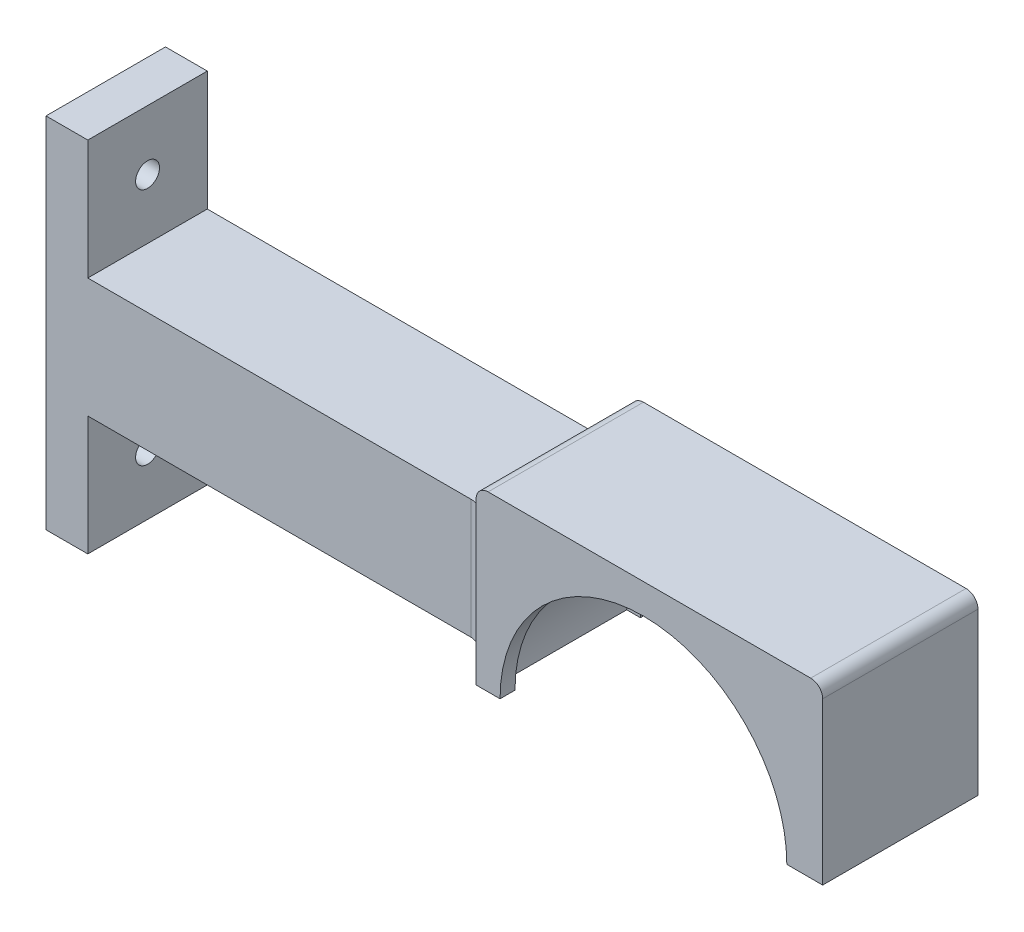
from build123d import *

# Parameters (mm, degrees)
SKETCH_5_W          = 28
SKETCH_5_H          = 13
EXTRUDE_4_DEPTH     = 13.5
SKETCH_6_W          = 13.15
SKETCH_6_H          = 10.5
SKETCH_8_R          = 12
CUT_EXTRUDE_1_DEPTH = 13
SKETCH_9_W          = 28
SKETCH_9_H          = 13
EXTRUDE_5_DEPTH     = 1
SKETCH_11_W         = 13
SKETCH_11_H         = 14.5
EXTRUDE_6_DEPTH     = 1
FILLET_1_R          = 1
SKETCH_12_W         = 10
SKETCH_12_H         = 10
EXTRUDE_7_DEPTH     = 37.5
SKETCH_13_W         = 10
SKETCH_13_H         = 30
SKETCH_13_R         = 1
EXTRUDE_8_DEPTH     = 3.5
FILLET_2_R          = 2
FILLET_3_R          = 1


with BuildPart() as part:
    # 스케치5 → 보스-돌출4 (new body)
    with BuildSketch(Plane(origin=(0, 0, 0), x_dir=(1, 0, 0), z_dir=(0, 1, 0))):
        Rectangle(SKETCH_5_W, SKETCH_5_H)
    extrude(amount=EXTRUDE_4_DEPTH)

    # 컷-스윕1: sweep along a path in 스케치7
    with BuildLine(Plane.XY.offset(6.5)) as sweep_1_path:
        CenterArc((0, 0), 13.15, 0, 360)
    # 스케치6 → 컷-스윕1 (sweep, cut)
    with BuildSketch(Plane.XZ):
        with Locations((6.575, 0)):
            Rectangle(SKETCH_6_W, SKETCH_6_H)
    sweep(path=sweep_1_path.line, mode=Mode.SUBTRACT)

    # 스케치8 → 컷-돌출1 (cut)
    with BuildSketch(Plane.XY.offset(6.5)):
        Circle(SKETCH_8_R)
    extrude(amount=-CUT_EXTRUDE_1_DEPTH, mode=Mode.SUBTRACT)

    # 스케치9 → 보스-돌출5 (add)
    with BuildSketch(Plane(origin=(0, 13.5, 0), x_dir=(1, 0, 0), z_dir=(0, 1, 0))):
        Rectangle(SKETCH_9_W, SKETCH_9_H)
    extrude(amount=EXTRUDE_5_DEPTH)

    # 스케치11 → 보스-돌출6 (add)
    with BuildSketch(Plane(origin=(14, 0, 0), x_dir=(0, 0, -1), z_dir=(1, 0, 0))):
        with Locations((0, 7.25)):
            Rectangle(SKETCH_11_W, SKETCH_11_H)
    extrude(amount=EXTRUDE_6_DEPTH)

    # 필렛1
    fillet_1_edges = [part.edges().sort_by_distance(p)[0] for p in [
        (-14, 14.5, 0),
        (15, 14.5, 0),
    ]]
    fillet(fillet_1_edges, radius=FILLET_1_R)

    # 스케치12 → 보스-돌출7 (add)
    with BuildSketch(Plane.ZY.offset(14)):
        with Locations((0, 6.75)):
            Rectangle(SKETCH_12_W, SKETCH_12_H)
    extrude(amount=EXTRUDE_7_DEPTH)

    # 스케치13 → 보스-돌출8 (add)
    with BuildSketch(Plane.ZY.offset(51.5)):
        with Locations((0, 6.75)):
            Rectangle(SKETCH_13_W, SKETCH_13_H)
        with Locations((0, 16.75)):
            Circle(SKETCH_13_R, mode=Mode.SUBTRACT)
        with Locations((0, -3.25)):
            Circle(SKETCH_13_R, mode=Mode.SUBTRACT)
    extrude(amount=-EXTRUDE_8_DEPTH)

    # 필렛2
    # the kernel refuses this fillet: 2 mm, written as the material it adds along each edge
    with BuildSketch(Plane(origin=(-14, 11.75, 5), x_dir=(0, 0, 1), z_dir=(0, -1, 0)), Plane(origin=(-14, 1.75, -5), x_dir=(0, 0, -1), z_dir=(0, 1, 0))) as fillet_2_piece_1:
        with BuildLine():
            CenterArc((2, 1.936491673), FILLET_2_R, 180, 75.522487814)
            Line((0, 1.936491673), (-0.04, 1.936491673))
            Line((-0.04, 1.936491673), (-0.04, 0))
            Line((-0.04, 0), (0, -0.04))
            ThreePointArc((0, -0.04), (0.75, -0.04), (1.49, -0.038729833))
            Line((1.49, -0.038729833), (1.5, 0))
        make_face()
    extrude(amount=10)
    with BuildSketch(Plane(origin=(-14, 1.75, 5), x_dir=(0, -1, 0), z_dir=(0, 0, -1))) as fillet_2_piece_2:
        with BuildLine():
            CenterArc((2, 1.984313483), FILLET_2_R, 180, 82.819244219)
            Line((0, 1.984313483), (-0.04, 1.984313483))
            Line((-0.04, 1.984313483), (-0.04, 0))
            Line((-0.04, 0), (0, -0.04))
            ThreePointArc((0, -0.04), (0.875, -0.04), (1.745, -0.03968627))
            Line((1.745, -0.03968627), (1.75, 0))
        make_face()
    extrude(amount=10)
    with BuildSketch(Plane(origin=(-14, 11.75, 5), x_dir=(0, 0, 1), z_dir=(0, -1, 0))) as fillet_2_piece_3a_section:
        with BuildLine():
            CenterArc((2, 1.936491673), FILLET_2_R, 180, 75.522487814)
            Line((0, 1.936491673), (-0.04, 1.936491673))
            Line((-0.04, 1.936491673), (-0.04, 0))
            Line((-0.04, 0), (0, -0.04))
            ThreePointArc((0, -0.04), (0.75, -0.04), (1.49, -0.038729833))
            Line((1.49, -0.038729833), (1.5, 0))
        make_face()
    fillet_2_piece_3a = extrude(amount=14.841229183, mode=Mode.PRIVATE)
    fillet_2_piece_3a = split(fillet_2_piece_3a, bisect_by=Plane(origin=(-14.456288202, 0, 5.379183511), z_dir=(0, 1, 0)), keep=Keep.TOP, mode=Mode.PRIVATE)
    fillet_2_piece_3a = split(fillet_2_piece_3a, bisect_by=Plane(origin=(-14.456288202, 1.75, 5.379183511), z_dir=(0, -1, 0)), keep=Keep.TOP, mode=Mode.PRIVATE)
    with BuildSketch(Plane(origin=(-14, 1.75, 9.960783708), x_dir=(0, -1, 0), z_dir=(0, 0, -1))) as fillet_2_piece_3b_section:
        with BuildLine():
            CenterArc((2, 1.984313483), FILLET_2_R, 180, 82.819244219)
            Line((0, 1.984313483), (-0.04, 1.984313483))
            Line((-0.04, 1.984313483), (-0.04, 0))
            Line((-0.04, 0), (0, -0.04))
            ThreePointArc((0, -0.04), (0.875, -0.04), (1.745, -0.03968627))
            Line((1.745, -0.03968627), (1.75, 0))
        make_face()
    fillet_2_piece_3b = extrude(amount=14.960783708, mode=Mode.PRIVATE)
    fillet_2_piece_3b = split(fillet_2_piece_3b, bisect_by=Plane(origin=(-14.456897386, 1.324929313, 6.5), z_dir=(0, 0, -1)), keep=Keep.TOP, mode=Mode.PRIVATE)
    fillet_2_piece_3b = split(fillet_2_piece_3b, bisect_by=Plane(origin=(-14.456897386, 1.324929313, 5), z_dir=(0, 0, 1)), keep=Keep.TOP, mode=Mode.PRIVATE)
    fillet_2_piece_3 = fillet_2_piece_3a & fillet_2_piece_3b
    add(fillet_2_piece_3)
    with BuildSketch(Plane(origin=(-14, 1.75, 5), x_dir=(0, -1, 0), z_dir=(0, 0, -1))) as fillet_2_piece_4a_section:
        with BuildLine():
            CenterArc((2, 1.984313483), FILLET_2_R, 180, 82.819244219)
            Line((0, 1.984313483), (-0.04, 1.984313483))
            Line((-0.04, 1.984313483), (-0.04, 0))
            Line((-0.04, 0), (0, -0.04))
            ThreePointArc((0, -0.04), (0.875, -0.04), (1.745, -0.03968627))
            Line((1.745, -0.03968627), (1.75, 0))
        make_face()
    fillet_2_piece_4a = extrude(amount=14.960783708, mode=Mode.PRIVATE)
    fillet_2_piece_4a = split(fillet_2_piece_4a, bisect_by=Plane(origin=(-14.456897386, 1.324929313, -6.5), z_dir=(0, 0, 1)), keep=Keep.TOP, mode=Mode.PRIVATE)
    fillet_2_piece_4a = split(fillet_2_piece_4a, bisect_by=Plane(origin=(-14.456897386, 1.324929313, -5), z_dir=(0, 0, -1)), keep=Keep.TOP, mode=Mode.PRIVATE)
    with BuildSketch(Plane(origin=(-14, -3.091229183, -5), x_dir=(0, 0, -1), z_dir=(0, 1, 0))) as fillet_2_piece_4b_section:
        with BuildLine():
            CenterArc((2, 1.936491673), FILLET_2_R, 180, 75.522487814)
            Line((0, 1.936491673), (-0.04, 1.936491673))
            Line((-0.04, 1.936491673), (-0.04, 0))
            Line((-0.04, 0), (0, -0.04))
            ThreePointArc((0, -0.04), (0.75, -0.04), (1.49, -0.038729833))
            Line((1.49, -0.038729833), (1.5, 0))
        make_face()
    fillet_2_piece_4b = extrude(amount=14.841229183, mode=Mode.PRIVATE)
    fillet_2_piece_4b = split(fillet_2_piece_4b, bisect_by=Plane(origin=(-14.456288202, 0, -5.379183511), z_dir=(0, 1, 0)), keep=Keep.TOP, mode=Mode.PRIVATE)
    fillet_2_piece_4b = split(fillet_2_piece_4b, bisect_by=Plane(origin=(-14.456288202, 1.75, -5.379183511), z_dir=(0, -1, 0)), keep=Keep.TOP, mode=Mode.PRIVATE)
    fillet_2_piece_4 = fillet_2_piece_4a & fillet_2_piece_4b
    add(fillet_2_piece_4)

    # 필렛3
    # the kernel refuses this fillet: 1 mm, written as the material it adds along each edge
    with BuildSketch(Plane(origin=(-14, 11.75, 6.5), x_dir=(0, 1, 0), z_dir=(0, 0, -1))) as fillet_3_piece_1_section:
        with BuildLine():
            CenterArc((FILLET_3_R, -FILLET_3_R), FILLET_3_R, 90, 90)
            Line((0, -FILLET_3_R), (0, 0))
            Line((0, 0), (FILLET_3_R, 0))
        make_face()
    fillet_3_piece_1 = extrude(amount=13, mode=Mode.PRIVATE)
    fillet_3_piece_1 = fillet_3_piece_1 - Plane(origin=(-15.936491673, 11.983902991, -7), x_dir=(0, 0, -1), z_dir=(0, -1, 0)) * Cylinder(2, 30, mode=Mode.PRIVATE)
    fillet_3_piece_1 = fillet_3_piece_1 - Plane(origin=(-15.936491673, 11.983902991, 7), x_dir=(0, 0, 1), z_dir=(0, 1, 0)) * Cylinder(2, 30, mode=Mode.PRIVATE)
    add(fillet_3_piece_1)


solid = part.part
